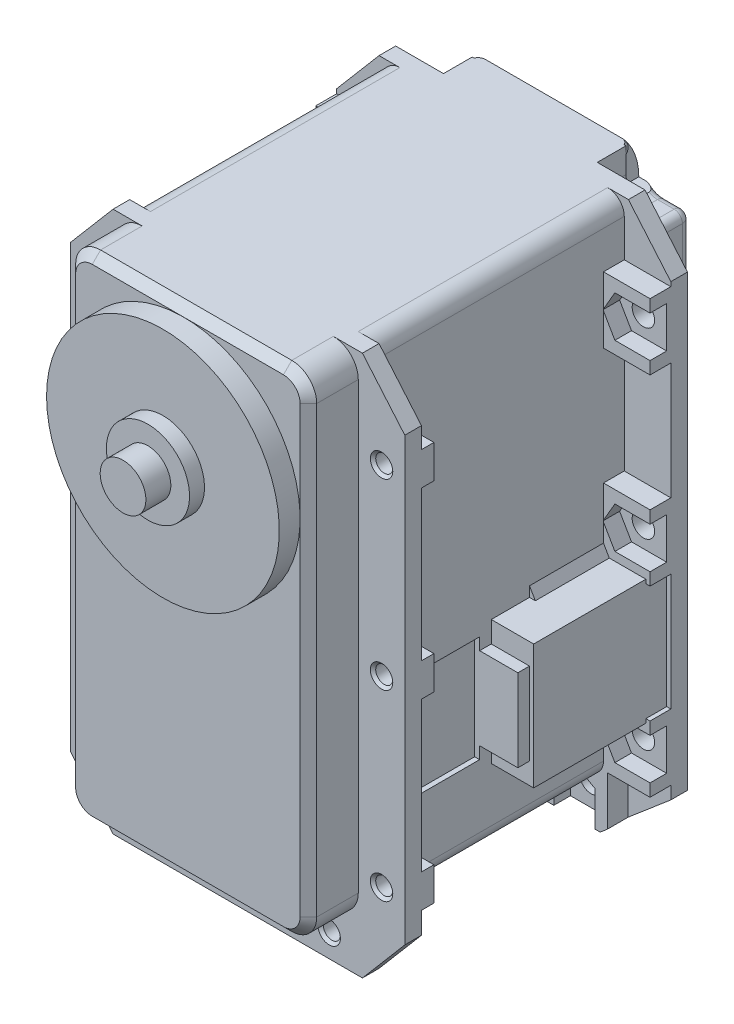
from build123d import *
from OCP.BRepFilletAPI import BRepFilletAPI_MakeChamfer

# Parameters (mm, degrees)
CUT_EXTRUDE1_START               = -18.5
CUT_EXTRUDE1_DEPTH               = 17.5
CUT_EXTRUDE1_START_2             = -1
CUT_EXTRUDE1_2_DEPTH             = 1
CUT_EXTRUDE1_3_ANGLE             = 5.606947
CUT_EXTRUDE2_DEPTH               = 0.9999999999999991
BOSS_EXTRUDE3_DEPTH              = 0.25000000025601077
SKETCH6_W                        = 29
SKETCH6_H                        = 2.5407373711561902
BOSS_EXTRUDE4_DEPTH              = 49
SKETCH7_W                        = 18.5
SKETCH7_H                        = 2.5407373711561902
BOSS_EXTRUDE5_DEPTH              = 5.249999999999998
BOSS_EXTRUDE6_DEPTH              = 0.9592626288438058
BOSS_EXTRUDE7_DEPTH              = 36.5
CUT_EXTRUDE3_DEPTH               = 33
CUT_EXTRUDE4_DEPTH               = 3.365000000000005
CUT_EXTRUDE5_DEPTH               = 3.4999999999999982
CUT_EXTRUDE6_DEPTH               = 0.1349999999999997
CUT_EXTRUDE7_DEPTH               = 1.3650000000000015
CUT_EXTRUDE8_DEPTH               = 26.000000000000004
CUT_EXTRUDE9_DEPTH               = 2.0000000000000018
CUT_EXTRUDE10_DEPTH              = 0.13499999999999795
CUT_EXTRUDE11_DEPTH              = 27.999999999999996
CUT_EXTRUDE12_START              = -0.1349999999999962
CUT_EXTRUDE12_DEPTH              = 0.1349999999999962
CUT_EXTRUDE13_START              = -26.000000000000004
CUT_EXTRUDE13_DEPTH              = 26.000000000000004
CUT_EXTRUDE14_DEPTH              = 2.0000000000000004
CUT_EXTRUDE15_DEPTH              = 2
CUT_EXTRUDE16_DEPTH              = 1.9999999999999982
CUT_EXTRUDE17_DEPTH              = 2
CUT_EXTRUDE18_DEPTH              = 3.5000000000000018
CUT_EXTRUDE19_DEPTH              = 29.500000000000004
CUT_EXTRUDE20_DEPTH              = 26.000000000000004
SKETCH28_W                       = 40.20000000000001
SKETCH28_H                       = 7.000000000000002
BOSS_EXTRUDE8_DEPTH              = 1.3710580837600004
CUT_EXTRUDE21_DEPTH              = 2
CUT_EXTRUDE22_DEPTH              = 1.9999999999999962
CUT_EXTRUDE23_DEPTH              = 1.9999999999999967
CUT_EXTRUDE24_DEPTH              = 2.0000000000000018
CUT_EXTRUDE25_DEPTH              = 1.9999999999999982
CUT_EXTRUDE26_DEPTH              = 1.9999999999999982
CUT_EXTRUDE27_DEPTH              = 1.9999999999999982
CUT_EXTRUDE28_DEPTH              = 2.0000000000000018
BOSS_EXTRUDE9_DEPTH              = 4.22894191624
CUT_EXTRUDE29_DEPTH              = 2.0000000000000018
CUT_EXTRUDE30_DEPTH              = 0.5000000000000004
BOSS_EXTRUDE10_DEPTH             = 4.600000000000006
SKETCH41_W                       = 3.4999999999999982
SKETCH41_H                       = 65.1
BOSS_EXTRUDE11_DEPTH             = 5.600000000000006
SKETCH42_W                       = 5.1
SKETCH42_H                       = 15
BOSS_EXTRUDE12_DEPTH             = 13.500000000000002
SKETCH43_W                       = 4.6
SKETCH43_H                       = 9.900000000000002
BOSS_EXTRUDE13_DEPTH             = 1.3999999999999997
CUT_EXTRUDE31_DEPTH              = 0.5999999999999999
SKETCH45_W                       = 5.1
SKETCH45_H                       = 15
BOSS_EXTRUDE14_DEPTH             = 13.500000000000002
SKETCH46_W                       = 4.6
SKETCH46_H                       = 9.900000000000002
BOSS_EXTRUDE15_DEPTH             = 1.3999999999999997
CUT_EXTRUDE32_DEPTH              = 0.5999999999999999
CUT_EXTRUDE33_DEPTH              = 8.599999999999996
BOSS_EXTRUDE16_START             = 0.15000000000000083
BOSS_EXTRUDE16_DEPTH             = 0.15000000000000083
BOSS_EXTRUDE17_DEPTH             = 0.14999999999999736
CUT_EXTRUDE34_DEPTH              = 0.13499999999999623
CUT_EXTRUDE35_DEPTH              = 23.500000000000004
SKETCH53_W                       = 1.5
SKETCH53_H                       = 52.5
CUT_EXTRUDE36_DEPTH              = 5.600000000000002
SKETCH54_W                       = 1.5
SKETCH54_H                       = 52.5
CUT_EXTRUDE37_DEPTH              = 5.600000000000002
SKETCH55_W                       = 14.050000000000004
SKETCH55_H                       = 2.5
CUT_EXTRUDE38_DEPTH              = 5.6000000000000005
SKETCH56_W                       = 2.5
SKETCH56_H                       = 6.525000000000002
CUT_EXTRUDE39_DEPTH              = 5.600000000000002
SKETCH57_W                       = 2.5
SKETCH57_H                       = 14.049999999999999
CUT_EXTRUDE40_DEPTH              = 5.600000000000002
SKETCH58_W                       = 2.5
SKETCH58_H                       = 14.049999999999997
CUT_EXTRUDE41_DEPTH              = 0.5000000000000004
SKETCH59_W                       = 2.5
SKETCH59_H                       = 6.525000000000002
CUT_EXTRUDE42_DEPTH              = 5.600000000000002
SKETCH60_W                       = 2.5
SKETCH60_H                       = 14.049999999999997
CUT_EXTRUDE43_DEPTH              = 0.5000000000000004
SKETCH61_W                       = 2.5
SKETCH61_H                       = 14.05
CUT_EXTRUDE44_DEPTH              = 5.600000000000002
BOSS_EXTRUDE18_DEPTH             = 5.6000000000000005
SKETCH63_W                       = 1.5
SKETCH63_H                       = 4
BOSS_EXTRUDE19_DEPTH             = 5.600000000000002
BOSS_EXTRUDE20_DEPTH             = 5.600000000000002
BOSS_EXTRUDE21_DEPTH             = 5.600000000000002
SKETCH66_W                       = 1.5
SKETCH66_H                       = 4.0000000000000036
BOSS_EXTRUDE22_DEPTH             = 5.600000000000002
BOSS_EXTRUDE23_DEPTH             = 8.9
SKETCH68_W                       = 5.125000000000007
SKETCH68_H                       = 6.625
CUT_EXTRUDE45_DEPTH              = 2.4999999999999987
CUT_EXTRUDE46_DEPTH              = 6.624999999999999
BOSS_EXTRUDE24_DEPTH             = 5.999999999999998
BOSS_EXTRUDE25_DEPTH             = 8.9
SKETCH72_W                       = 3.8
SKETCH72_H                       = 5.9
CUT_EXTRUDE47_DEPTH              = 1.0000000000000009
F_15_0_15_DIAMETER_HOLE1_D       = 15
F_15_0_15_DIAMETER_HOLE1_DEPTH   = 1
F_2_7_2_7_DIAMETER_HOLE1_D       = 2.7
F_2_7_2_7_DIAMETER_HOLE1_DEPTH   = 10
F_2_05_2_05_DIAMETER_HOLE1_D     = 2.05
F_2_05_2_05_DIAMETER_HOLE1_DEPTH = 41.5
F_3_2_3_2_DIAMETER_HOLE1_D       = 3.2
F_3_2_3_2_DIAMETER_HOLE1_DEPTH   = 2.2
FILLET1_R                        = 2
FILLET2_R                        = 2.2500000000000004
FILLET3_R                        = 2.9999999999999996
CHAMFER1_SIZE                    = 0.32499999997499107
CHAMFER2_SIZE                    = 5.099999999999656
CHAMFER2_SIZE2                   = 6.000000000000282
CHAMFER2_SIZE2_2                 = 6.00000000000029
CHAMFER3_SIZE                    = 5.09999999999966
CHAMFER3_SIZE2                   = 6.000000000000299
CHAMFER3_SIZE2_2                 = 6.000000000000289
CHAMFER4_SIZE                    = 6.000000000000296
CHAMFER4_SIZE2                   = 5.09999999999966
CHAMFER4_SIZE2_2                 = 5.099999999999663
CHAMFER5_SIZE                    = 6.000000000000293
CHAMFER5_SIZE2                   = 5.099999999999658
CHAMFER6_SIZE                    = 0.9999999986121122
FILLET4_R                        = 1


with BuildPart() as part:
    # Cut-Extrude1: read off the stored shape, not the designer's step
    # Cut-Extrude1 outline → Cut-Extrude1 (new body)
    with BuildSketch(Plane(origin=(9.250000000000002, 0, 0), x_dir=(0, 0, -1), z_dir=(1, 0, 0)).offset(CUT_EXTRUDE1_START)):
        with BuildLine():
            Line((20.459262629, 9.5), (23, 9.5))
            ThreePointArc((23, 9.5), (22.481456009, 12.192582404), (21, 14.5))
            Line((21, 14.5), (20.459262629, 14.5))
            Line((20.459262629, 14.5), (20.459262629, 9.5))
        make_face()
    extrude(amount=CUT_EXTRUDE1_DEPTH)

    # Cut-Extrude1 2 outline → Cut-Extrude1 2 (add)
    with BuildSketch(Plane(origin=(9.250000000000002, 0, 0), x_dir=(0, 0, -1), z_dir=(1, 0, 0)).offset(CUT_EXTRUDE1_START_2)):
        with BuildLine():
            Line((20.459262629, 13.609693785), (21.212448374, 14.266986235))
            ThreePointArc((21.212448374, 14.266986235), (21.107491147, 14.384648258), (21, 14.5))
            Line((21, 14.5), (20.459262629, 14.5))
            Line((20.459262629, 14.5), (20.459262629, 13.609693785))
        make_face()
    extrude(amount=CUT_EXTRUDE1_2_DEPTH)

    # Cut-Extrude1 3 outline → Cut-Extrude1 3 (revolve, cut)
    with BuildSketch(Plane(origin=(0, 9.5, -15.75), x_dir=(0, 0.657483407976528, -0.7534690227445123), z_dir=(0, -0.7534690227445123, -0.657483407976528))):
        with BuildLine():
            ThreePointArc((7.25, -8.25), (6.957226623, -8.956986919), (6.250338992, -9.249999942))
            Line((6.250338992, -9.249999942), (7.25, -9.249999994))
            Line((7.25, -9.249999994), (7.25, -8.25))
        make_face()
        with BuildLine():
            ThreePointArc((6.250338992, 9.249999943), (6.957226623, 8.956986919), (7.25, 8.25))
            Line((7.25, 8.25), (7.25, 9.25))
            Line((7.25, 9.25), (6.250338992, 9.249999943))
        make_face()
    revolve(axis=Axis((0, 9.5, -15.75), (1, 0, 0)), revolution_arc=CUT_EXTRUDE1_3_ANGLE, mode=Mode.SUBTRACT)

    # Sketch2 → Cut-Extrude2 (cut)
    with BuildSketch(Plane.ZY.offset(9.25)):
        with BuildLine():
            Line((-23, 9.500000000256), (-20.45886528259516, 9.500000000256))
            Line((-20.45886528259516, 9.500000000256), (-20.45886528259516, 13.609742153112794))
            Line((-20.45886528259516, 13.609742153112794), (-21.212221305895127, 14.267246417783138))
            ThreePointArc((-21.212221305895127, 14.267246417783138), (-22.53835784515444, 12.045721463050029), (-23, 9.500000000256))
        make_face()
    extrude(amount=-CUT_EXTRUDE2_DEPTH, mode=Mode.SUBTRACT)

    # Sketch5 → Boss-Extrude3 (add)
    with BuildSketch(Plane.XZ.offset(-9.500000000256)):
        Polygon((-9.25, -20.45926262884381), (9.25, -20.45926262884381), (9.25, -23), (-9.249999999999998, -23), align=None)
    extrude(amount=BOSS_EXTRUDE3_DEPTH)

    # Sketch6 → Boss-Extrude4 (add)
    with BuildSketch(Plane.XZ.offset(-9.24999999999999)):
        with Locations((-1.78e-15, -21.729631314421887)):
            Rectangle(SKETCH6_W, SKETCH6_H)
    extrude(amount=BOSS_EXTRUDE4_DEPTH)

    # Sketch7 → Boss-Extrude5 (add)
    with BuildSketch(Plane.XZ.offset(39.750000000000014)):
        with Locations((1.78e-15, -21.729631314421905)):
            Rectangle(SKETCH7_W, SKETCH7_H)
    extrude(amount=BOSS_EXTRUDE5_DEPTH)

    # Sketch8 → Boss-Extrude6 (add)
    with BuildSketch(Plane.XY.offset(-20.45926262884381)):
        Polygon((-9.25, 9.25), (-9.25, 14.5), (9.25, 14.5), (9.25, 9.25), (14.5, 9.249999999999995), (14.5, -39.75), (9.25, -39.75), (9.25, -45), (-9.25, -45), (-9.25, -39.75), (-14.5, -39.75), (-14.5, 9.25), align=None)
    extrude(amount=BOSS_EXTRUDE6_DEPTH)

    # Sketch9 → Boss-Extrude7 (add)
    with BuildSketch(Plane.XY.offset(-19.500000000000004)):
        Polygon((-15.5, -45), (-20.100000000000005, -45), (-20.100000000000005, 14.5), (20.100000000000005, 14.5), (20.100000000000005, -45), (14.499999999999996, -45), (14.5, -50.6), (-15.5, -50.6), align=None)
    extrude(amount=BOSS_EXTRUDE7_DEPTH)

    # Sketch10 → Cut-Extrude3 (cut)
    with BuildSketch(Plane(origin=(0, 0, -19.500000000000004), x_dir=(-1, 0, 0), z_dir=(0, 0, -1))):
        Polygon((-14.499999999999996, -50.6), (15.5, -50.6), (15.5, -45), (-14.5, -45), align=None)
    extrude(amount=-CUT_EXTRUDE3_DEPTH, mode=Mode.SUBTRACT)

    # Sketch11 → Cut-Extrude4 (cut)
    with BuildSketch(Plane.XY.offset(16.999999999999993)):
        Polygon((-20.100000000000005, -45), (-15.50000000000086, -45), (-15.50000000000086, 5.832308546370023), (-15.87105808376, 6.475), (-20.100000000000005, 6.474999999999999), align=None)
    extrude(amount=-CUT_EXTRUDE4_DEPTH, mode=Mode.SUBTRACT)

    # Sketch12 → Cut-Extrude5 (cut)
    with BuildSketch(Plane.XY.offset(16.999999999999993)):
        Polygon((15.871058083756818, 6.475000000001838), (14.5, 4.100257738806999), (14.5, -45), (20.100000000000005, -45), (20.100000000000005, 6.475000000001838), align=None)
    extrude(amount=-CUT_EXTRUDE5_DEPTH, mode=Mode.SUBTRACT)

    # Sketch13 → Cut-Extrude6 (cut)
    with BuildSketch(Plane(origin=(0, 0, 13.499999999999998), x_dir=(-1, 0, 0), z_dir=(0, 6.2e-16, -1))):
        Polygon((15.5, -44.99999999999999), (13.000000000000002, -44.99999999999999), (13.000000000000004, -50.599999999999994), (15.5, -50.599999999999994), align=None)
    extrude(amount=-CUT_EXTRUDE6_DEPTH, mode=Mode.SUBTRACT)

    # Sketch14 → Cut-Extrude7 (cut)
    with BuildSketch(Plane(origin=(0, -8.45e-15, 13.634999999999998), x_dir=(-1, 0, -6.9e-16), z_dir=(6.9e-16, -3.1e-16, -1))):
        with BuildLine():
            Line((15.499999999999991, -50.60000000000001), (15.499999999999991, -42.00000000000001))
            Line((15.499999999999991, -42.00000000000001), (14.23205080756887, -42.00000000000001))
            ThreePointArc((14.23205080756887, -42.00000000000001), (14.344250129034574, -43.77378385971532), (12.999999999999993, -44.936491673103724))
            Line((12.999999999999993, -44.936491673103724), (12.999999999999995, -50.60000000000001))
            Line((12.999999999999995, -50.60000000000001), (15.499999999999991, -50.60000000000001))
        make_face()
    extrude(amount=-CUT_EXTRUDE7_DEPTH, mode=Mode.SUBTRACT)

    # Sketch15 → Cut-Extrude8 (cut)
    with BuildSketch(Plane.XY.offset(13.499999999999996)):
        Polygon((15.871058083756818, 6.475000000001838), (14.5, 4.100257738806999), (14.5, -45), (20.100000000000005, -45), (20.100000000000005, 6.475000000001838), align=None)
    extrude(amount=-CUT_EXTRUDE8_DEPTH, mode=Mode.SUBTRACT)

    # Sketch16 → Cut-Extrude9 (cut)
    with BuildSketch(Plane.XY.offset(-12.500000000000005)):
        Polygon((14.5, 4.100257738806998), (14.5, 3.899742261190911), (15.871058083755916, 1.5249999999976407), (20.099999999998023, 1.5249999999976407), (20.099999999998023, 6.4750000000018355), (15.871058083756822, 6.475000000001835), align=None)
    extrude(amount=-CUT_EXTRUDE9_DEPTH, mode=Mode.SUBTRACT)

    # Sketch17 → Cut-Extrude10 (cut)
    with BuildSketch(Plane.XY.offset(13.63499999999999)):
        Polygon((-15.87105808376002, 1.5249999999999997), (-15.500000000000883, 2.167691453629974), (-15.500000000000883, 5.8323085463713), (-15.87105808376002, 6.475000000001276), (-20.100000000000023, 6.475000000001275), (-20.100000000000023, 1.5250000000000004), align=None)
    extrude(amount=-CUT_EXTRUDE10_DEPTH, mode=Mode.SUBTRACT)

    # Sketch18 → Cut-Extrude11 (cut)
    with BuildSketch(Plane.XY.offset(13.499999999999991)):
        Polygon((-14.50000000000318, 3.8997422611948362), (-14.50000000000318, 4.100257738808993), (-15.87105808376, 6.475000000003827), (-20.100000000000005, 6.475000000003826), (-20.100000000000005, 1.5250000000000004), (-15.87105808376, 1.5249999999999997), align=None)
    extrude(amount=-CUT_EXTRUDE11_DEPTH, mode=Mode.SUBTRACT)

    # Sketch19 → Cut-Extrude12 (cut)
    with BuildSketch(Plane.XY.offset(13.63499999999999).offset(CUT_EXTRUDE12_START)):
        with BuildLine():
            Line((-15.500000000000883, -41.9999999999995), (-15.500000000000883, 2.1676914536299745))
            Line((-15.500000000000883, 2.1676914536299745), (-15.87105808376002, 1.5250000000000001))
            Line((-15.87105808376002, 1.5250000000000001), (-20.100000000000023, 1.5250000000000004))
            Line((-20.100000000000023, 1.5250000000000004), (-20.100000000000023, -45))
            Line((-20.100000000000023, -45), (-13.000000000000883, -45))
            Line((-13.000000000000883, -45), (-13.000000000000883, -44.93649167310321))
            ThreePointArc((-13.000000000000883, -44.93649167310321), (-14.081138830085072, -44.224744871391096), (-14.500000000000881, -42.9999999999995))
            ThreePointArc((-14.500000000000881, -42.9999999999995), (-14.792893218814335, -42.29289321881296), (-15.500000000000883, -41.9999999999995))
        make_face()
    extrude(amount=CUT_EXTRUDE12_DEPTH, mode=Mode.SUBTRACT)

    # Sketch20 → Cut-Extrude13 (cut)
    with BuildSketch(Plane.XY.offset(13.499999999999993).offset(CUT_EXTRUDE13_START)):
        with BuildLine():
            Line((-14.5, -43), (-14.5, 3.8997422611930004))
            Line((-14.5, 3.8997422611930004), (-15.871058083756818, 1.5249999999981636))
            Line((-15.871058083756818, 1.5249999999981636), (-20.10000000000001, 1.524999999998163))
            Line((-20.10000000000001, 1.524999999998163), (-20.100000000000005, -45))
            Line((-20.100000000000005, -45), (-12.5, -45))
            ThreePointArc((-12.5, -45), (-13.914213562373096, -44.41421356237309), (-14.5, -43))
        make_face()
    extrude(amount=CUT_EXTRUDE13_DEPTH, mode=Mode.SUBTRACT)

    # Sketch21 → Cut-Extrude14 (cut)
    with BuildSketch(Plane.XY.offset(-12.500000000000009)):
        Polygon((-14.500000000004475, -40.10025773880741), (-14.500000000004475, -39.89974226118745), (-15.871058083759996, -37.52499999999486), (-20.100000000000005, -37.52499999999486), (-20.100000000000005, -42.475), (-15.87105808376, -42.47500000000001), align=None)
    extrude(amount=-CUT_EXTRUDE14_DEPTH, mode=Mode.SUBTRACT)

    # Sketch22 → Cut-Extrude15 (cut)
    with BuildSketch(Plane.XY.offset(-12.500000000000005)):
        Polygon((14.500000000000394, -17.89974226119), (14.500000000000394, -18.100257738809777), (15.871058083755912, -20.47500000000236), (20.09999999999802, -20.47500000000236), (20.09999999999802, -15.524999999997414), (15.871058083755916, -15.524999999997414), align=None)
    extrude(amount=-CUT_EXTRUDE15_DEPTH, mode=Mode.SUBTRACT)

    # Sketch23 → Cut-Extrude16 (cut)
    with BuildSketch(Plane.XY.offset(-12.500000000000005)):
        Polygon((14.5, -39.89974226118999), (14.50000000000039, -40.100257738809766), (15.871058083755916, -42.47500000000236), (20.099999999998023, -42.47500000000236), (20.099999999998023, -37.52499999999759), (15.87105808375581, -37.52499999999758), align=None)
    extrude(amount=-CUT_EXTRUDE16_DEPTH, mode=Mode.SUBTRACT)

    # Sketch24 → Cut-Extrude17 (cut)
    with BuildSketch(Plane.XY.offset(-12.500000000000009)):
        Polygon((-14.500000000004478, -18.100257738807414), (-14.500000000004478, -17.899742261188763), (-15.87105808376, -15.524999999996174), (-20.100000000000005, -15.524999999996174), (-20.100000000000005, -20.475), (-15.87105808376, -20.475), align=None)
    extrude(amount=-CUT_EXTRUDE17_DEPTH, mode=Mode.SUBTRACT)

    # Sketch25 → Cut-Extrude18 (cut)
    with BuildSketch(Plane.XY.offset(16.999999999999993)):
        Polygon((-15.871058083760003, 6.475000000000001), (-15.500000000000862, 5.8323085463700215), (-15.500000000000862, 14.5), (-20.100000000000005, 14.5), (-20.100000000000005, 6.474999999999999), align=None)
    extrude(amount=-CUT_EXTRUDE18_DEPTH, mode=Mode.SUBTRACT)

    # Sketch26 → Cut-Extrude19 (cut)
    with BuildSketch(Plane.XY.offset(16.999999999999993)):
        Polygon((14.5, 4.100257738806999), (15.871058083756822, 6.475000000001835), (20.099999999996825, 6.475000000001835), (20.099999999996825, 14.5), (14.5, 14.5), align=None)
    extrude(amount=-CUT_EXTRUDE19_DEPTH, mode=Mode.SUBTRACT)

    # Sketch27 → Cut-Extrude20 (cut)
    with BuildSketch(Plane.XY.offset(13.499999999999993)):
        Polygon((-20.100000000000005, 6.474999999999999), (-15.871058083760003, 6.475000000000001), (-14.500000000003183, 4.100257738805164), (-14.500000000003183, 14.5), (-20.100000000000005, 14.5), align=None)
    extrude(amount=-CUT_EXTRUDE20_DEPTH, mode=Mode.SUBTRACT)

    # Sketch28 → Boss-Extrude8 (add)
    with BuildSketch(Plane.XZ.offset(45.000000000000014)):
        with Locations((0, -16.000000000000004)):
            Rectangle(SKETCH28_W, SKETCH28_H)
    extrude(amount=BOSS_EXTRUDE8_DEPTH)

    # Sketch29 → Cut-Extrude21 (cut)
    with BuildSketch(Plane(origin=(0, 0, -14.5), x_dir=(-1, 0, 0), z_dir=(0, 0, -1))):
        Polygon((14.44211616751105, -17.999999999999396), (14.500000000001272, -18.100257738809262), (14.500000000001272, -17.89974226119061), align=None)
    extrude(amount=-CUT_EXTRUDE21_DEPTH, mode=Mode.SUBTRACT)

    # Sketch30 → Cut-Extrude22 (cut)
    with BuildSketch(Plane(origin=(0, 0, -14.5), x_dir=(-1, 0, 0), z_dir=(0, 0, -1))):
        Polygon((14.500000000000327, 4.100257738807345), (14.442116167511404, 4.00000000000081), (14.500000000000327, 3.899742261193189), align=None)
    extrude(amount=-CUT_EXTRUDE22_DEPTH, mode=Mode.SUBTRACT)

    # Sketch31 → Cut-Extrude23 (cut)
    with BuildSketch(Plane(origin=(0, 0, -14.5), x_dir=(-1, 0, 0), z_dir=(0, 0, -1))):
        Polygon((-14.499999999999998, 3.8997422611930017), (-14.442116167511077, 4.00000000000062), (-14.5, 4.100257738806999), align=None)
    extrude(amount=-CUT_EXTRUDE23_DEPTH, mode=Mode.SUBTRACT)

    # Sketch32 → Cut-Extrude24 (cut)
    with BuildSketch(Plane(origin=(0, 0, -14.5), x_dir=(-1, 0, 0), z_dir=(0, 0, -1))):
        Polygon((-14.442116167509779, -18.00000000000013), (-14.499999999999998, -17.89974226119), (-14.5, -18.10025773881), align=None)
    extrude(amount=-CUT_EXTRUDE24_DEPTH, mode=Mode.SUBTRACT)

    # Sketch33 → Cut-Extrude25 (cut)
    with BuildSketch(Plane(origin=(0, 0, -14.5), x_dir=(-1, 0, 0), z_dir=(0, 0, -1))):
        Polygon((-14.442116167510003, -40), (-14.5, -39.89974226118999), (-14.499999999999996, -40.10025773880999), align=None)
    extrude(amount=-CUT_EXTRUDE25_DEPTH, mode=Mode.SUBTRACT)

    # Sketch34 → Cut-Extrude26 (cut)
    with BuildSketch(Plane.XY.offset(-12.500000000000005)):
        Polygon((11.000000000000634, -44.94211616751531), (8.525000000000002, -46.37105808376), (13.475, -46.37105808376), align=None)
    extrude(amount=-CUT_EXTRUDE26_DEPTH, mode=Mode.SUBTRACT)

    # Sketch35 → Cut-Extrude27 (cut)
    with BuildSketch(Plane.XY.offset(-12.500000000000005)):
        Polygon((-10.999999999999366, -44.94211616751531), (-13.475000000000001, -46.37105808376), (-8.525000000000002, -46.37105808376), align=None)
    extrude(amount=-CUT_EXTRUDE27_DEPTH, mode=Mode.SUBTRACT)

    # Sketch36 → Cut-Extrude28 (cut)
    with BuildSketch(Plane(origin=(0, 0, -14.5), x_dir=(-1, 0, 0), z_dir=(0, 0, -1))):
        Polygon((14.442116167511404, -39.9999999999992), (14.50000000000162, -40.100257738809056), (14.50000000000162, -39.8997422611891), align=None)
    extrude(amount=-CUT_EXTRUDE28_DEPTH, mode=Mode.SUBTRACT)

    # Sketch37 → Boss-Extrude9 (add)
    with BuildSketch(Plane.XZ.offset(46.37105808376001)):
        Polygon((20.100000000000005, -12.5), (20.100000000000005, -19.500000000000004), (-20.100000000000005, -19.500000000000004), (-20.100000000000005, -12.5), (-13.475, -12.5), (-13.475000000000001, -14.5), (-8.525000000000002, -14.5), (-8.525000000000002, -12.5), (8.525000000000002, -12.5), (8.525000000000002, -14.5), (13.475, -14.5), (13.475, -12.5), align=None)
    extrude(amount=BOSS_EXTRUDE9_DEPTH)

    # Sketch38 → Cut-Extrude29 (cut)
    with BuildSketch(Plane(origin=(0, 0, -19.500000000000004), x_dir=(-1, 0, 0), z_dir=(0, 0, -1))):
        Polygon((14.5, 9.25), (14.5, -39.75), (9.25, -39.75), (9.25, -45), (-9.25, -45), (-9.25, -39.75), (-14.5, -39.75), (-14.5, 9.249999999999995), (-9.25, 9.25), (-9.25, 14.5), (-20.100000000000005, 14.5), (-20.100000000000005, -50.6), (20.100000000000005, -50.60000000000001), (20.10000000000001, 14.5), (9.25, 14.5), (9.25, 9.25), align=None)
    extrude(amount=-CUT_EXTRUDE29_DEPTH, mode=Mode.SUBTRACT)

    # Sketch39 → Cut-Extrude30 (cut)
    with BuildSketch(Plane(origin=(0, 0, -17.5), x_dir=(-1, 0, 0), z_dir=(0, 0, -1))):
        with BuildLine():
            Line((9.25, -39.75), (9.25, -44))
            ThreePointArc((9.25, -44), (8.957106781186548, -44.707106781186546), (8.25, -45))
            Line((8.25, -45), (-8.25, -45))
            ThreePointArc((-8.25, -45), (-8.957106781186548, -44.707106781186546), (-9.25, -44))
            Line((-9.25, -44), (-9.25, -39.75))
            Line((-9.25, -39.75), (-13.5, -39.75))
            ThreePointArc((-13.5, -39.75), (-14.207106781186548, -39.457106781186546), (-14.5, -38.75))
            Line((-14.5, -38.75), (-14.5, 8.25))
            ThreePointArc((-14.5, 8.25), (-14.207106781186548, 8.957106781186546), (-13.500000000000002, 9.250000000000004))
            Line((-13.500000000000002, 9.250000000000004), (-9.25, 9.25))
            Line((-9.25, 9.25), (-9.25, 14.5))
            Line((-9.25, 14.5), (-20.100000000000005, 14.5))
            Line((-20.100000000000005, 14.5), (-20.100000000000005, -50.6))
            Line((-20.100000000000005, -50.6), (20.100000000000005, -50.60000000000001))
            Line((20.100000000000005, -50.60000000000001), (20.10000000000001, 14.5))
            Line((20.10000000000001, 14.5), (9.25, 14.5))
            Line((9.25, 14.5), (9.25, 9.25))
            Line((9.25, 9.25), (13.5, 9.25))
            ThreePointArc((13.5, 9.25), (14.207106781186548, 8.957106781186548), (14.5, 8.25))
            Line((14.5, 8.25), (14.499999999999998, -38.75))
            ThreePointArc((14.499999999999998, -38.75), (14.207106781186546, -39.457106781186546), (13.5, -39.75))
            Line((13.5, -39.75), (9.25, -39.75))
        make_face()
    extrude(amount=-CUT_EXTRUDE30_DEPTH, mode=Mode.SUBTRACT)

    # Sketch40 → Boss-Extrude10 (add)
    with BuildSketch(Plane.ZY.offset(15.5)):
        Polygon((13.5, 14.5), (17, 14.5), (17, -50.6), (15, -50.6), (15, -42), (13.5, -42), align=None)
    extrude(amount=BOSS_EXTRUDE10_DEPTH)

    # Sketch41 → Boss-Extrude11 (add)
    with BuildSketch(Plane(origin=(14.49999999999997, 8.98e-15, 0), x_dir=(0, 0, -1), z_dir=(1, 6.2e-16, 0))):
        with Locations((-15.25, -18.050000000000004)):
            Rectangle(SKETCH41_W, SKETCH41_H)
    extrude(amount=BOSS_EXTRUDE11_DEPTH)

    # Sketch42 → Boss-Extrude12 (add)
    with BuildSketch(Plane.XY.offset(-12.500000000000005)):
        with Locations((17.05, -29)):
            Rectangle(SKETCH42_W, SKETCH42_H)
    extrude(amount=BOSS_EXTRUDE12_DEPTH)

    # Sketch43 → Boss-Extrude13 (add)
    with BuildSketch(Plane.XY.offset(0.9999999999999957)):
        with Locations((16.8, -29)):
            Rectangle(SKETCH43_W, SKETCH43_H)
    extrude(amount=BOSS_EXTRUDE13_DEPTH)

    # Sketch44 → Cut-Extrude31 (cut)
    with BuildSketch(Plane(origin=(14.49999999999997, 8.98e-15, 0), x_dir=(0, 0, -1), z_dir=(1, 6.2e-16, 0))):
        Polygon((-2.4, -35.400000000000006), (-2.3999999999999995, -22.600000000000012), (-12.5, -22.600000000000012), (-12.5, -35.400000000000006), align=None)
    extrude(amount=-CUT_EXTRUDE31_DEPTH, mode=Mode.SUBTRACT)

    # Sketch45 → Boss-Extrude14 (add)
    with BuildSketch(Plane.XY.offset(-12.500000000000009)):
        with Locations((-17.05, -29)):
            Rectangle(SKETCH45_W, SKETCH45_H)
    extrude(amount=BOSS_EXTRUDE14_DEPTH)

    # Sketch46 → Boss-Extrude15 (add)
    with BuildSketch(Plane.XY.offset(0.9999999999999922)):
        with Locations((-16.8, -29)):
            Rectangle(SKETCH46_W, SKETCH46_H)
    extrude(amount=BOSS_EXTRUDE15_DEPTH)

    # Sketch47 → Cut-Extrude32 (cut)
    with BuildSketch(Plane.ZY.offset(14.50000000000318)):
        Polygon((2.4, -22.6), (2.3999999999999995, -35.4), (12.5, -35.4), (12.5, -22.6), align=None)
    extrude(amount=-CUT_EXTRUDE32_DEPTH, mode=Mode.SUBTRACT)

    # Sketch48 → Cut-Extrude33 (cut)
    with BuildSketch(Plane.XZ.offset(50.6)):
        Polygon((14.5, 14.865000000000004), (14.5, 13.499999999999998), (20.100000000000005, 13.5), (20.100000000000005, 14.865000000000004), align=None)
    extrude(amount=-CUT_EXTRUDE33_DEPTH, mode=Mode.SUBTRACT)

    # Sketch49 → Boss-Extrude16 (add)
    with BuildSketch(Plane(origin=(-1.041e-14, 4.65e-15, 15), x_dir=(-1, 0, -6.9e-16), z_dir=(6.9e-16, -3.1e-16, -1)).offset(BOSS_EXTRUDE16_START)):
        with BuildLine():
            Line((14.232050807568868, -42.00000000000001), (15.49999999999999, -42.00000000000001))
            ThreePointArc((15.49999999999999, -42.00000000000001), (14.792893218813441, -42.29289321881346), (14.499999999999991, -43.00000000000001))
            ThreePointArc((14.499999999999991, -43.00000000000001), (14.431851652578128, -42.48236190979497), (14.232050807568868, -42.00000000000001))
        make_face()
    extrude(amount=-BOSS_EXTRUDE16_DEPTH)

    # Sketch50 → Boss-Extrude17 (add)
    with BuildSketch(Plane(origin=(0, 0, 13.499999999999996), x_dir=(-1, 0, 0), z_dir=(0, 0, -1))):
        with BuildLine():
            Line((-14.5, -42), (-15.5, -42))
            ThreePointArc((-15.5, -42), (-14.792893218813452, -42.292893218813454), (-14.5, -43))
            Line((-14.5, -43), (-14.5, -42))
        make_face()
    extrude(amount=-BOSS_EXTRUDE17_DEPTH)

    # Sketch51 → Cut-Extrude34 (cut)
    with BuildSketch(Plane(origin=(0, 0, 14.865000000000004), x_dir=(-1, 0, 0), z_dir=(0, 0, -1))):
        with BuildLine():
            Line((-20.10000000000001, -50.6), (-14.500000000000002, -50.6))
            Line((-14.500000000000002, -50.6), (-14.499999999999998, -43))
            ThreePointArc((-14.499999999999998, -43), (-14.79289321881345, -42.292893218813454), (-15.5, -42))
            Line((-15.5, -42), (-20.100000000000005, -42))
            Line((-20.100000000000005, -42), (-20.10000000000001, -50.6))
        make_face()
    extrude(amount=-CUT_EXTRUDE34_DEPTH, mode=Mode.SUBTRACT)

    # Sketch52 → Cut-Extrude35 (cut)
    with BuildSketch(Plane(origin=(14.49999999999997, 8.98e-15, 0), x_dir=(0, 0, -1), z_dir=(1, 6.2e-16, 0))):
        Polygon((-13.5, -50.60000000000001), (-13.499999999999998, -45.00000000000001), (-15, -45.00000000000001), (-15, -50.60000000000001), align=None)
    extrude(amount=-CUT_EXTRUDE35_DEPTH, mode=Mode.SUBTRACT)

    # Sketch53 → Cut-Extrude36 (cut)
    with BuildSketch(Plane.ZY.offset(20.10000000000001)):
        with Locations((14.25000000000002, -11.75)):
            Rectangle(SKETCH53_W, SKETCH53_H)
    extrude(amount=-CUT_EXTRUDE36_DEPTH, mode=Mode.SUBTRACT)

    # Sketch54 → Cut-Extrude37 (cut)
    with BuildSketch(Plane(origin=(20.099999999999977, 1.232e-14, 0), x_dir=(0, 0, -1), z_dir=(1, 0, 0))):
        with Locations((-14.250000000000002, -11.75)):
            Rectangle(SKETCH54_W, SKETCH54_H)
    extrude(amount=-CUT_EXTRUDE37_DEPTH, mode=Mode.SUBTRACT)

    # Sketch55 → Cut-Extrude38 (cut)
    with BuildSketch(Plane.XZ.offset(50.600000000000016)):
        with Locations((0, -13.750000000000002)):
            Rectangle(SKETCH55_W, SKETCH55_H)
    extrude(amount=-CUT_EXTRUDE38_DEPTH, mode=Mode.SUBTRACT)

    # Sketch56 → Cut-Extrude39 (cut)
    with BuildSketch(Plane.ZY.offset(20.100000000000005)):
        with Locations((-13.750000000000002, 11.2375)):
            Rectangle(SKETCH56_W, SKETCH56_H)
    extrude(amount=-CUT_EXTRUDE39_DEPTH, mode=Mode.SUBTRACT)

    # Sketch57 → Cut-Extrude40 (cut)
    with BuildSketch(Plane.ZY.offset(20.100000000000005)):
        with Locations((-13.750000000000002, -6.999999999999999)):
            Rectangle(SKETCH57_W, SKETCH57_H)
    extrude(amount=-CUT_EXTRUDE40_DEPTH, mode=Mode.SUBTRACT)

    # Sketch58 → Cut-Extrude41 (cut)
    with BuildSketch(Plane.ZY.offset(20.100000000000005)):
        with Locations((-13.750000000000002, -29)):
            Rectangle(SKETCH58_W, SKETCH58_H)
    extrude(amount=-CUT_EXTRUDE41_DEPTH, mode=Mode.SUBTRACT)

    # Sketch59 → Cut-Extrude42 (cut)
    with BuildSketch(Plane(origin=(20.100000000000005, 0, 0), x_dir=(0, 0, -1), z_dir=(1, 0, 0))):
        with Locations((13.750000000000002, 11.2375)):
            Rectangle(SKETCH59_W, SKETCH59_H)
    extrude(amount=-CUT_EXTRUDE42_DEPTH, mode=Mode.SUBTRACT)

    # Sketch60 → Cut-Extrude43 (cut)
    with BuildSketch(Plane(origin=(20.100000000000005, 0, 0), x_dir=(0, 0, -1), z_dir=(1, 0, 0))):
        with Locations((13.750000000000002, -29)):
            Rectangle(SKETCH60_W, SKETCH60_H)
    extrude(amount=-CUT_EXTRUDE43_DEPTH, mode=Mode.SUBTRACT)

    # Sketch61 → Cut-Extrude44 (cut)
    with BuildSketch(Plane(origin=(20.100000000000005, 0, 0), x_dir=(0, 0, -1), z_dir=(1, 0, 0))):
        with Locations((13.750000000000002, -7)):
            Rectangle(SKETCH61_W, SKETCH61_H)
    extrude(amount=-CUT_EXTRUDE44_DEPTH, mode=Mode.SUBTRACT)

    # Sketch62 → Boss-Extrude18 (add)
    with BuildSketch(Plane.XZ.offset(45.000000000000014)):
        Polygon((9.000000000000002, 13.5), (9.000000000000002, 15), (13.000000000000002, 15), (13.000000000000004, 13.5), align=None)
    extrude(amount=BOSS_EXTRUDE18_DEPTH)

    # Sketch63 → Boss-Extrude19 (add)
    with BuildSketch(Plane(origin=(14.49999999999997, 8.98e-15, 0), x_dir=(0, 0, -1), z_dir=(1, 6.2e-16, 0))):
        with Locations((-14.250000000000002, -18.00000000000001)):
            Rectangle(SKETCH63_W, SKETCH63_H)
    extrude(amount=BOSS_EXTRUDE19_DEPTH)

    # Sketch64 → Boss-Extrude20 (add)
    with BuildSketch(Plane(origin=(14.49999999999997, 8.98e-15, 0), x_dir=(0, 0, -1), z_dir=(1, 6.2e-16, 0))):
        Polygon((-13.5, 1.999999999999991), (-15, 1.9999999999999927), (-15, 5.99999999999999), (-13.499999999999998, 5.999999999999991), align=None)
    extrude(amount=BOSS_EXTRUDE20_DEPTH)

    # Sketch65 → Boss-Extrude21 (add)
    with BuildSketch(Plane.ZY.offset(14.50000000000318)):
        Polygon((15, 2), (13.5, 2), (13.499999999999998, 6), (15, 6), align=None)
    extrude(amount=BOSS_EXTRUDE21_DEPTH)

    # Sketch66 → Boss-Extrude22 (add)
    with BuildSketch(Plane.ZY.offset(14.50000000000318)):
        with Locations((14.250000000000002, -18)):
            Rectangle(SKETCH66_W, SKETCH66_H)
    extrude(amount=BOSS_EXTRUDE22_DEPTH)

    # Sketch67 → Boss-Extrude23 (add)
    with BuildSketch(Plane.XY.offset(-12.500000000000005)):
        Polygon((14.5, -20.2875644347), (15.200000000000776, -21.499999999999556), (14.5, -21.499999999999556), align=None)
    extrude(amount=BOSS_EXTRUDE23_DEPTH)

    # Sketch68 → Cut-Extrude45 (cut)
    with BuildSketch(Plane.XY.offset(-12.500000000000005)):
        with Locations((17.5375, -47.2875)):
            Rectangle(SKETCH68_W, SKETCH68_H)
    extrude(amount=-CUT_EXTRUDE45_DEPTH, mode=Mode.SUBTRACT)

    # Sketch69 → Cut-Extrude46 (cut)
    with BuildSketch(Plane.XZ.offset(50.600000000000016)):
        Polygon((-20.100000000000005, -15), (-14.975, -15), (-14.975000000000001, -12.5), (-20.100000000000005, -12.5), align=None)
    extrude(amount=-CUT_EXTRUDE46_DEPTH, mode=Mode.SUBTRACT)

    # Sketch70 → Boss-Extrude24 (add)
    with BuildSketch(Plane.XY.offset(16.999999999999993)):
        Polygon((-14.5, -45), (-14.5, 14.5), (14.5, 14.499999999999998), (14.5, -45), align=None)
    extrude(amount=BOSS_EXTRUDE24_DEPTH)

    # Sketch71 → Boss-Extrude25 (add)
    with BuildSketch(Plane.XY.offset(-12.500000000000009)):
        Polygon((-14.499999999999492, -20.287564434700293), (-14.499999999999494, -21.49999999999985), (-15.200000000000268, -21.49999999999985), align=None)
    extrude(amount=BOSS_EXTRUDE25_DEPTH)

    # Sketch72 → Cut-Extrude47 (cut)
    with BuildSketch(Plane.ZY.offset(14.50000000000318)):
        with Locations((-6.9, -10.5)):
            Rectangle(SKETCH72_W, SKETCH72_H)
    extrude(amount=-CUT_EXTRUDE47_DEPTH, mode=Mode.SUBTRACT)

    # Ø15.0 (15) Diameter Hole1
    with Locations(Plane(origin=(0, 0, -23), x_dir=(-1, 0, 0), z_dir=(0, 0, -1))):
        with Locations((0, 0)):
            Hole(F_15_0_15_DIAMETER_HOLE1_D / 2, depth=F_15_0_15_DIAMETER_HOLE1_DEPTH)

    # Sketch75 → Revolve1 (revolve)
    with BuildSketch(Plane.XZ, mode=Mode.PRIVATE) as revolve1_sk:
        Polygon((2.75, 30.8), (0, 30.8), (0, 23), (9.000000000000002, 23), (9.000000000000002, 23.5), (14, 23.5), (14, 26.000000000000004), (5, 26.000000000000004), (5, 27.8), (2.75, 27.8), align=None)
    revolve(revolve1_sk.sketch.rotate(Axis((0, 0, 30.8), (0, 0, -1)), 180), axis=Axis((0, 0, 30.8), (0, 0, -1)))

    # Sketch76 → Revolve2 (revolve)
    with BuildSketch(Plane.XZ, mode=Mode.PRIVATE) as revolve2_sk:
        Polygon((5, -22), (0, -22), (0, -24.5), (4, -24.5), (4, -22.3), (5, -22.3), align=None)
    revolve(revolve2_sk.sketch.rotate(Axis((0, 0, -22), (0, 0, -1)), 180), axis=Axis((0, 0, -22), (0, 0, -1)))

    # Ø2.7 (2.7) Diameter Hole1
    with Locations(Plane.XY.offset(-14.500000000000005)):
        with Locations((-17.3, 4), (-17.3, -18), (-11, -47.8), (17.3, 4), (17.3, -18), (11, -47.8), (-17.3, -40), (17.3, -40)):
            Hole(F_2_7_2_7_DIAMETER_HOLE1_D / 2, depth=F_2_7_2_7_DIAMETER_HOLE1_DEPTH)

    # Ø2.05 (2.05) Diameter Hole1
    with Locations(Plane.XY.offset(16.999999999999993)):
        with Locations((17.3, 4), (17.3, -18), (17.3, -40), (11, -47.8), (-17.3, 4), (-17.3, -18), (-17.3, -40), (-11, -47.8)):
            Hole(F_2_05_2_05_DIAMETER_HOLE1_D / 2, depth=F_2_05_2_05_DIAMETER_HOLE1_DEPTH)

    # Ø3.2 (3.2) Diameter Hole1
    with Locations(Plane(origin=(0, 0, -24.5), x_dir=(-1, 0, 0), z_dir=(0, 0, -1))):
        with Locations((0, 0)):
            Hole(F_3_2_3_2_DIAMETER_HOLE1_D / 2, depth=F_3_2_3_2_DIAMETER_HOLE1_DEPTH)

    # Fillet1
    fillet1_edges = [part.edges().sort_by_distance(p)[0] for p in [
        (14.49999999999999, 14.500000000000005, 0),
        (-14.500000000000012, 14.5, 1.243e-14),
        (14.5, -45, 1.2499999999999964),
    ]]
    fillet(fillet1_edges, radius=FILLET1_R - 0.0001)  # a hair under: the kernel refuses the full size

    # Fillet2
    fillet2_edges = [part.edges().sort_by_distance(p)[0] for p in [
        (-9.250000000000005, -39.75000000000001, -19.999999999999957),
        (9.249999999999995, -39.75000000000001, -19.999999999999957),
        (9.25, 9.249999999999995, -20),
        (-9.25, 9.249999999999995, -20),
    ]]
    fillet(fillet2_edges, radius=FILLET2_R)

    # Fillet3
    fillet3_edges = [part.edges().sort_by_distance(p)[0] for p in [
        (14.5, 14.499999999999998, 19.999999999999993),
        (-14.5, 14.5, 19.999999999999993),
        (-14.5, -45, 19.999999999999993),
        (14.5, -45, 19.999999999999993),
    ]]
    fillet(fillet3_edges, radius=FILLET3_R)

    # Chamfer1
    chamfer1_edges = [part.edges().sort_by_distance(p)[0] for p in [
        (-9.975, -47.8, 16.999999999999993),
        (-16.275000000000002, -40, 16.999999999999993),
        (-16.275000000000002, -18, 16.999999999999993),
        (-16.275000000000002, 4, 16.999999999999993),
        (12.025, -47.8, 16.999999999999993),
        (18.325, -40, 16.999999999999993),
        (18.325, -18, 16.999999999999993),
        (18.325, 4, 16.999999999999993),
    ]]
    chamfer(chamfer1_edges, length=CHAMFER1_SIZE)

    # Chamfer2: one chamfer whose edges measure the first distance from different faces: ONE call of the kernel's chamfer builder (chamfer() names one face for all edges)
    chamfer2_edges_1 = [part.edges().sort_by_distance(p)[0] for p in [
        (20.100000000000005, 14.5, -16),
    ]]
    chamfer2_side_1 = [part.faces().sort_by_distance(p)[0] for p in [
        (-4.01582805e-09, 14.499999999999991, 1.2154352020072552),
    ]]
    chamfer2_edges_2 = [part.edges().sort_by_distance(p)[0] for p in [
        (-20.100000000000005, -50.60000000000001, -16),
    ]]
    chamfer2_side_2 = [part.faces().sort_by_distance(p)[0] for p in [
        (-1.8e-16, -50.600000000000016, -15.602017937219731),
    ]]
    chamfer2 = BRepFilletAPI_MakeChamfer(part.part.solid().wrapped)
    for e in chamfer2_edges_1:
        chamfer2.Add(CHAMFER2_SIZE, CHAMFER2_SIZE2, e.wrapped, chamfer2_side_1[0].wrapped)  # the first distance lies on this face
    for e in chamfer2_edges_2:
        chamfer2.Add(CHAMFER2_SIZE, CHAMFER2_SIZE2_2, e.wrapped, chamfer2_side_2[0].wrapped)  # the first distance lies on this face
    add(Compound.cast(chamfer2.Shape()), mode=Mode.REPLACE)

    # Chamfer3: one chamfer whose edges measure the first distance from different faces: ONE call of the kernel's chamfer builder (chamfer() names one face for all edges)
    chamfer3_edges_1 = [part.edges().sort_by_distance(p)[0] for p in [
        (-20.100000000000005, 14.5, 16.000000000000007),
    ]]
    chamfer3_side_1 = [part.faces().sort_by_distance(p)[0] for p in [
        (-0.16096287411297971, 14.499999999999991, 1.3733295529732148),
    ]]
    chamfer3_edges_2 = [part.edges().sort_by_distance(p)[0] for p in [
        (20.10000000000001, -50.599999999999994, 16),
    ]]
    chamfer3_side_2 = [part.faces().sort_by_distance(p)[0] for p in [
        (4.167e-14, -50.6, 15.772727272727249),
    ]]
    chamfer3 = BRepFilletAPI_MakeChamfer(part.part.solid().wrapped)
    for e in chamfer3_edges_1:
        chamfer3.Add(CHAMFER3_SIZE, CHAMFER3_SIZE2, e.wrapped, chamfer3_side_1[0].wrapped)  # the first distance lies on this face
    for e in chamfer3_edges_2:
        chamfer3.Add(CHAMFER3_SIZE, CHAMFER3_SIZE2_2, e.wrapped, chamfer3_side_2[0].wrapped)  # the first distance lies on this face
    add(Compound.cast(chamfer3.Shape()), mode=Mode.REPLACE)

    # Chamfer4: one chamfer whose edges measure the first distance from different faces: ONE call of the kernel's chamfer builder (chamfer() names one face for all edges)
    chamfer4_edges_1 = [part.edges().sort_by_distance(p)[0] for p in [
        (20.100000000000005, -50.60000000000001, -16),
    ]]
    chamfer4_side_1 = [part.faces().sort_by_distance(p)[0] for p in [
        (1.985690515806858, -50.60000000000001, -15.556988352745428),
    ]]
    chamfer4_edges_2 = [part.edges().sort_by_distance(p)[0] for p in [
        (-20.100000000000005, 14.5, -16),
    ]]
    chamfer4_side_2 = [part.faces().sort_by_distance(p)[0] for p in [
        (-20.100000000000005, -15.64597468354379, -15.59556962025352),
    ]]
    chamfer4 = BRepFilletAPI_MakeChamfer(part.part.solid().wrapped)
    for e in chamfer4_edges_1:
        chamfer4.Add(CHAMFER4_SIZE, CHAMFER4_SIZE2, e.wrapped, chamfer4_side_1[0].wrapped)  # the first distance lies on this face
    for e in chamfer4_edges_2:
        chamfer4.Add(CHAMFER4_SIZE, CHAMFER4_SIZE2_2, e.wrapped, chamfer4_side_2[0].wrapped)  # the first distance lies on this face
    add(Compound.cast(chamfer4.Shape()), mode=Mode.REPLACE)

    # Chamfer5: one chamfer whose edges measure the first distance from different faces: ONE call of the kernel's chamfer builder (chamfer() names one face for all edges)
    chamfer5_edges_1 = [part.edges().sort_by_distance(p)[0] for p in [
        (-20.100000000000005, -50.6, 16),
    ]]
    chamfer5_side_1 = [part.faces().sort_by_distance(p)[0] for p in [
        (-20.100000000000005, -20.64691629955963, 15.768722466960353),
    ]]
    chamfer5_edges_2 = [part.edges().sort_by_distance(p)[0] for p in [
        (20.099999999999966, 14.500000000000004, 16),
    ]]
    chamfer5_side_2 = [part.faces().sort_by_distance(p)[0] for p in [
        (20.099999999999987, -15.439867841409566, 15.768722466960352),
    ]]
    chamfer5 = BRepFilletAPI_MakeChamfer(part.part.solid().wrapped)
    for e in chamfer5_edges_1:
        chamfer5.Add(CHAMFER5_SIZE, CHAMFER5_SIZE2, e.wrapped, chamfer5_side_1[0].wrapped)  # the first distance lies on this face
    for e in chamfer5_edges_2:
        chamfer5.Add(CHAMFER5_SIZE, CHAMFER5_SIZE2, e.wrapped, chamfer5_side_2[0].wrapped)  # the first distance lies on this face
    add(Compound.cast(chamfer5.Shape()), mode=Mode.REPLACE)

    # Chamfer6
    chamfer6_edges = [part.edges().sort_by_distance(p)[0] for p in [
        (-1.78e-15, 14.5, 22.999999999999993),
        (14.5, -15.250000000000002, 22.999999999999993),
        (1.78e-15, -45, 22.999999999999993),
        (-14.5, -15.250000000000007, 22.999999999999993),
        (13.621320343559645, -44.121320343559645, 22.999999999999993),
        (-13.621320343559642, -44.121320343559645, 22.999999999999993),
        (-13.621320343559642, 13.621320343559628, 22.999999999999993),
        (13.621320343559642, 13.621320343559642, 22.999999999999993),
    ]]
    chamfer(chamfer6_edges, length=CHAMFER6_SIZE)

    # Fillet4
    fillet4_edges = [part.edges().sort_by_distance(p)[0] for p in [
        (-10.969669913838565, 9.313393039498866, -22.999999999999986),
        (-13.000000000000002, 9.249999999999947, -22.999999999999982),
        (-14.5, 9.249999999999973, -20.249999999999993),
        (-14.500000000000009, -15.250000000000053, -22.999999999999932),
        (-14.500000000000007, -39.75000000000003, -20.249999999999943),
        (-9.25000000000001, -43.50000000000001, -22.99999999999992),
        (-9.909009742330268, -40.40900974233027, -22.999999999999886),
        (-13.000000000000009, -39.75000000000006, -22.999999999999883),
        (-9.250000000000005, -45.00000000000001, -20.249999999999957),
        (9.249999999999995, -45.00000000000001, -20.249999999999957),
        (-1.043e-14, -45.000000000000014, -22.99999999999992),
        (14.499999999999993, -39.75000000000003, -20.249999999999943),
        (9.24999999999999, -43.50000000000001, -22.99999999999992),
        (9.909009742330268, -40.40900974233027, -22.99999999999988),
        (12.999999999999993, -39.750000000000064, -22.999999999999883),
        (14.499999999999991, -15.250000000000062, -22.999999999999932),
        (14.5, 9.249999999999966, -20.249999999999993),
        (13, 9.249999999999938, -22.999999999999982),
        (10.969669913838494, 9.313393039498825, -22.999999999999986),
        (-14.50000000000318, -20.000000000000004, 14.25),
        (14.499999999999982, -20, 14.25),
        (-14.50000000000318, 2, 14.25),
        (14.499999999999968, 2.000000000000001, 14.25),
        (-14.50000000000318, 6, 14.25),
        (-14.500000000000021, -38, 14.250000000000023),
        (-14.50000000000318, -16, 14.25),
        (14.499999999999966, 6, 14.25),
        (-14.232050807568868, -42.000000000000014, 14.242500000000003),
        (14.49999999999998, -16, 14.25),
        (14.499999999999975, -37.999999999999986, 14.25),
        (9.000000000000002, -45.000000000000014, 14.25),
        (-9.000000000000005, -45.000000000000014, 14.25),
        (-13.000000000000439, -44.936491673103475, 14.25),
        (13.000000000000032, -44.93651421188753, 14.25),
    ]]
    fillet(fillet4_edges, radius=FILLET4_R)


solid = part.part
